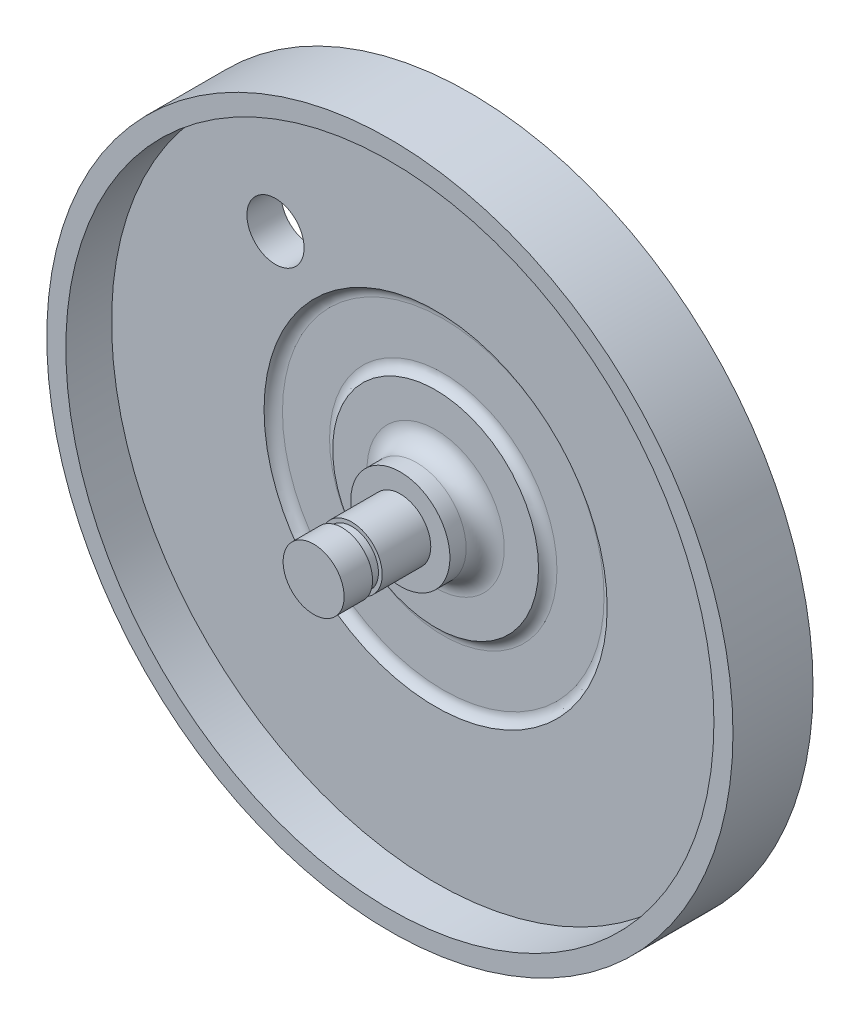
from build123d import *

# Parameters (mm, degrees)
BOSS_EXTRUDE1_DEPTH      = 2.5
BOSS_EXTRUDE1_DEPTH_BACK = 2
SKETCH1_R                = 45
SKETCH2_R                = 45
SKETCH2_R_2              = 42.5
BOSS_EXTRUDE2_DEPTH      = 6
SKETCH3_R                = 4
BOSS_EXTRUDE3_DEPTH      = 16
SKETCH4_R                = 4
SKETCH4_R_2              = 3.5
CUT_EXTRUDE1_DEPTH       = 1.27
CUT_EXTRUDE2_START       = -1.27
SKETCH5_R                = 4
SKETCH5_R_2              = 3.5
CUT_EXTRUDE2_DEPTH       = 1.27
CUT_EXTRUDE3_DEPTH       = 2
SKETCH7_R                = 3.75
CUT_EXTRUDE4_DEPTH       = 66.620118866
SKETCH8_R                = 22.5
SKETCH8_R_2              = 13.5
CUT_EXTRUDE5_DEPTH       = 1
FILLET2_R                = 1.5
SKETCH11_R               = 6.5
BOSS_EXTRUDE4_DEPTH      = 7.127
FILLET3_R                = 2.5


with BuildPart() as part:
    # Sketch1 → Boss-Extrude1 (new, two sides: drawn at the far end of the back side and taken through both)
    with BuildSketch(Plane.XY.offset(-BOSS_EXTRUDE1_DEPTH_BACK)):
        Circle(SKETCH1_R)
    extrude(amount=BOSS_EXTRUDE1_DEPTH + BOSS_EXTRUDE1_DEPTH_BACK)

    # Sketch2 → Boss-Extrude2 (add)
    with BuildSketch(Plane.XY.offset(2.5)):
        Circle(SKETCH2_R)
        Circle(SKETCH2_R_2, mode=Mode.SUBTRACT)
    extrude(amount=BOSS_EXTRUDE2_DEPTH)

    # Sketch3 → Boss-Extrude3 (add)
    with BuildSketch(Plane.XY.offset(2.5)):
        Circle(SKETCH3_R)
    extrude(amount=BOSS_EXTRUDE3_DEPTH)

    # Sketch4 → Cut-Extrude1 (cut)
    with BuildSketch(Plane.XY.offset(13.5)):
        Circle(SKETCH4_R)
        Circle(SKETCH4_R_2, mode=Mode.SUBTRACT)
    extrude(amount=CUT_EXTRUDE1_DEPTH, mode=Mode.SUBTRACT)

    # Sketch5 → Cut-Extrude2 (cut)
    with BuildSketch(Plane.XY.offset(7.135).offset(CUT_EXTRUDE2_START)):
        Circle(SKETCH5_R)
        Circle(SKETCH5_R_2, mode=Mode.SUBTRACT)
    extrude(amount=CUT_EXTRUDE2_DEPTH, mode=Mode.SUBTRACT)

    # Sketch6 → Cut-Extrude3 (cut)
    with BuildSketch(Plane(origin=(0, 0, -2), x_dir=(-1, 0, 0), z_dir=(0, 0, -1))):
        Polygon((-6.639528096, 0), (-3.319764048, -5.75), (3.319764048, -5.75), (6.639528096, 0), (3.319764048, 5.75), (-3.319764048, 5.75), align=None)
    extrude(amount=-CUT_EXTRUDE3_DEPTH, mode=Mode.SUBTRACT)

    # Sketch7 → Cut-Extrude4 (cut, through all)
    with BuildSketch(Plane.XY.offset(2.5)):
        with Locations((-21, 21)):
            Circle(SKETCH7_R)
    extrude(amount=-CUT_EXTRUDE4_DEPTH, mode=Mode.SUBTRACT)

    # Sketch8 → Cut-Extrude5 (cut)
    with BuildSketch(Plane.XY.offset(2.5)):
        Circle(SKETCH8_R)
        Circle(SKETCH8_R_2, mode=Mode.SUBTRACT)
    extrude(amount=-CUT_EXTRUDE5_DEPTH, mode=Mode.SUBTRACT)

    # Fillet2
    # the kernel refuses this fillet: 1.5 mm, written as the material it adds along each edge
    with BuildSketch(Plane(origin=(0, 0, 1.5), x_dir=(1, 0, 0), z_dir=(0, -1, 0))) as fillet2_piece_1:
        with BuildLine():
            CenterArc((21.085786438, 1.5), FILLET2_R, 270, 70.528779366)
            Line((21.085786438, 0), (21.085786438, -0.03))
            Line((21.085786438, -0.03), (22.5, -0.03))
            Line((22.5, -0.03), (22.53, 0))
            ThreePointArc((22.53, 0), (22.53, 0.5), (22.528284271, 0.99))
            Line((22.528284271, 0.99), (22.5, 1))
        make_face()
    revolve(axis=Axis((0, 0, 1.5), (0, 0, 1)))
    with BuildSketch(Plane(origin=(0, 0, 1.5), x_dir=(1, 0, 0), z_dir=(0, -1, 0))) as fillet2_piece_2:
        with BuildLine():
            CenterArc((14.914213562, 1.5), FILLET2_R, 199.471220634, 70.528779366)
            Line((13.5, 1), (13.471715729, 0.99))
            ThreePointArc((13.471715729, 0.99), (13.47, 0.5), (13.47, 0))
            Line((13.47, 0), (13.5, -0.03))
            Line((13.5, -0.03), (14.914213562, -0.03))
            Line((14.914213562, -0.03), (14.914213562, 0))
        make_face()
    revolve(axis=Axis((0, 0, 1.5), (0, 0, 1)))

    # Sketch11 → Boss-Extrude4 (add)
    with BuildSketch(Plane(origin=(0, 0, 0), x_dir=(-1, 0, 0), z_dir=(0, 0, -1))):
        Circle(SKETCH11_R)
    extrude(amount=-BOSS_EXTRUDE4_DEPTH)

    # Fillet3
    fillet3_edges = [part.edges().sort_by_distance(p)[0] for p in [
        (6.5, 0, 2.5),
    ]]
    fillet(fillet3_edges, radius=FILLET3_R)


solid = part.part
